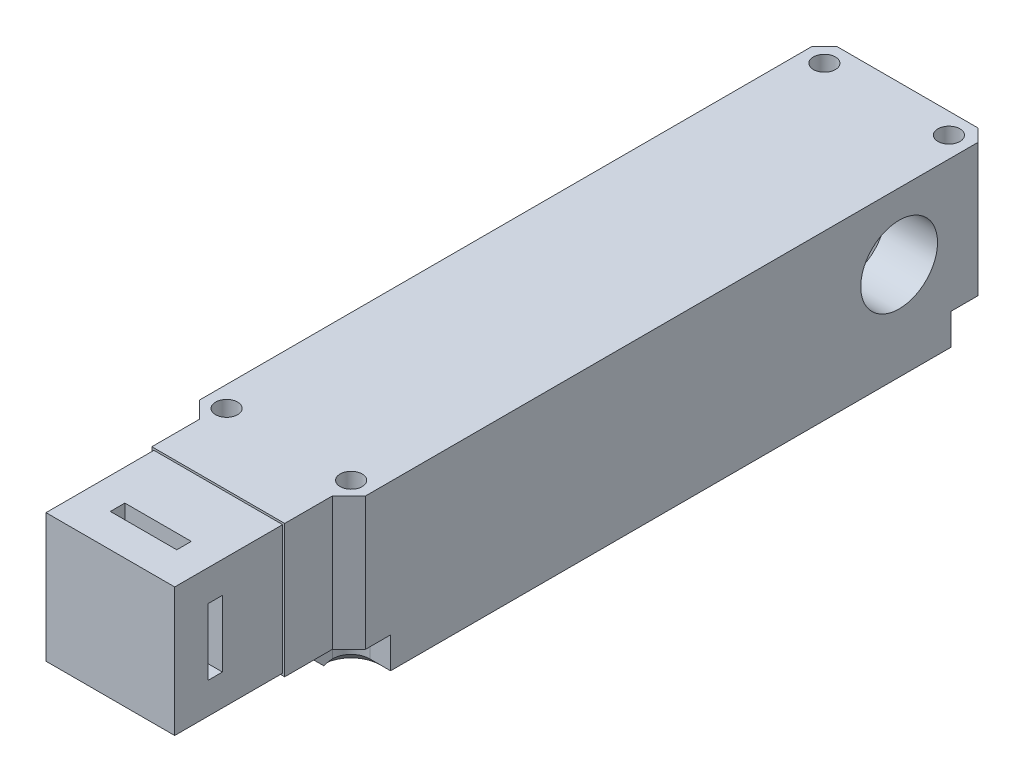
from build123d import *

# Parameters (mm, degrees)
SKIZZE1_R                       = 2.65
AUFSATZ_LINEAR_AUSTRAGEN1_DEPTH = 32
SKIZZE2_W                       = 31
SKIZZE2_H                       = 31
AUFSATZ_LINEAR_AUSTRAGEN2_DEPTH = 26
AUFSATZ_LINEAR_AUSTRAGEN3_DEPTH = 10
FASE2_SIZE                      = 4.5
FASE1_SIZE                      = 2.5
M20X1_5_GEWINDEBOHRUNG1_D       = 18.5
M20X1_5_GEWINDEBOHRUNG1_DEPTH   = 8
M20X1_5_GEWINDEBOHRUNG1_TIP     = 5.557960726
M20X1_5_GEWINDEBOHRUNG2_D       = 18.5
M20X1_5_GEWINDEBOHRUNG2_DEPTH   = 12.5
M20X1_5_GEWINDEBOHRUNG2_TIP     = 5.557960726
M20X1_5_GEWINDEBOHRUNG3_D       = 18.5
M20X1_5_GEWINDEBOHRUNG3_DEPTH   = 12.5
M20X1_5_GEWINDEBOHRUNG3_TIP     = 5.557960726
SKIZZE10_W                      = 6
SKIZZE10_H                      = 16
SKIZZE10_W_2                    = 16
SKIZZE10_H_2                    = 6
SCHNITT_LINEAR_AUSTRAGEN1_DEPTH = 3.5


with BuildPart() as part:
    # Skizze1 → Aufsatz-Linear austragen1 (new body)
    with BuildSketch(Plane(origin=(0, 0, 0), x_dir=(1, 0, 0), z_dir=(0, 1, 0))):
        Polygon((16, -17), (-16, -17), (-16, -5.5), (-20, -1.5), (-20, 146), (-17, 149), (17, 149), (20, 146), (20, -1.5), (16, -5.5), align=None)
        with Locations(Location((15, 0, 0), (0, 0, 270))):
            Circle(SKIZZE1_R, mode=Mode.SUBTRACT)
        with Locations(Location((-15, 0, 0), (0, 0, 270))):
            Circle(SKIZZE1_R, mode=Mode.SUBTRACT)
        with Locations(Location((-15, 144, 0), (0, 0, 270))):
            Circle(SKIZZE1_R, mode=Mode.SUBTRACT)
        with Locations(Location((15, 144, 0), (0, 0, 270))):
            Circle(SKIZZE1_R, mode=Mode.SUBTRACT)
    extrude(amount=-AUFSATZ_LINEAR_AUSTRAGEN1_DEPTH)

    # Skizze2 → Aufsatz-Linear austragen2 (add)
    with BuildSketch(Plane.XY.offset(17)):
        with Locations((0, -16)):
            Rectangle(SKIZZE2_W, SKIZZE2_H)
    extrude(amount=AUFSATZ_LINEAR_AUSTRAGEN2_DEPTH)

    # Skizze3 → Aufsatz-Linear austragen3 (add)
    with BuildSketch(Plane.XZ.offset(32)):
        with BuildLine():
            Line((20, -4.5), (15, -4.5))
            ThreePointArc((15, -4.5), (11.818019485, -3.181980515), (10.5, 0))
            Line((10.5, 0), (10.5, 4.5))
            Line((10.5, 4.5), (-10.5, 4.5))
            Line((-10.5, 4.5), (-10.5, 0))
            ThreePointArc((-10.5, 0), (-11.818019485, -3.181980515), (-15, -4.5))
            Line((-15, -4.5), (-20, -4.5))
            Line((-20, -4.5), (-20, -139.5))
            Line((-20, -139.5), (-15, -139.5))
            ThreePointArc((-15, -139.5), (-11.818019485, -140.818019485), (-10.5, -144))
            Line((-10.5, -144), (-10.5, -149))
            Line((-10.5, -149), (10.5, -149))
            Line((10.5, -149), (10.5, -144))
            ThreePointArc((10.5, -144), (11.818019485, -140.818019485), (15, -139.5))
            Line((15, -139.5), (20, -139.5))
            Line((20, -139.5), (20, -4.5))
        make_face()
    extrude(amount=AUFSATZ_LINEAR_AUSTRAGEN3_DEPTH)

    # Fase2
    fase2_edges = [part.edges().sort_by_distance(p)[0] for p in [
        (0, -42, 4.5),
        (0, -42, -149),
    ]]
    chamfer(fase2_edges, length=FASE2_SIZE)

    # Fase1
    # the kernel refuses this chamfer: 2.5 mm, written as the material it takes off along each edge
    with BuildSketch(Plane(origin=(10.5, -42, -150.92920747), x_dir=(0.027495876610586282, 0.9996219169112968, 0), z_dir=(0, 0, 1)), Plane(origin=(-10.5, -42, -144), x_dir=(-0.027495876610586282, 0.9996219169112968, 0), z_dir=(0, 0, -1))) as fase1_piece_1:
        Polygon((FASE1_SIZE * 0.999621916911, FASE1_SIZE * 0.0274958766106), (-FASE1_SIZE * 0.0274958766106, FASE1_SIZE * 0.999621916911), (0, 0), align=None)
    extrude(amount=6.92920747, mode=Mode.SUBTRACT)
    with BuildSketch(Plane(origin=(20, -42, -145.92920747), x_dir=(-0.9996219169112968, -0.0274958766105877, 0), z_dir=(0, 0, 1)), Plane(origin=(-20, -42, 1.92920747), x_dir=(0.9996219169112968, -0.0274958766105877, 0), z_dir=(0, 0, -1))) as fase1_piece_2:
        Polygon((FASE1_SIZE * 0.999621916911, -FASE1_SIZE * 0.0274958766106), (-FASE1_SIZE * 0.0274958766106, -FASE1_SIZE * 0.999621916911), (0, 0), align=None)
    extrude(amount=147.85841494, mode=Mode.SUBTRACT)
    with BuildSketch(Plane(origin=(26.42920747, -42, -4.5), x_dir=(0, -0.0274958766105877, -0.9996219169112968), z_dir=(-1, 0, 0)), Plane(origin=(-15, -42, -4.5), x_dir=(0, -0.0274958766105877, -0.9996219169112968), z_dir=(-1, 0, 0)), Plane(origin=(-26.42920747, -42, -139.5), x_dir=(0, -0.027495876610587815, 0.9996219169112968), z_dir=(1, 0, 0)), Plane(origin=(15, -42, -139.5), x_dir=(0, -0.027495876610587815, 0.9996219169112968), z_dir=(1, 0, 0))) as fase1_piece_3:
        Polygon((FASE1_SIZE * 0.999621916911, -FASE1_SIZE * 0.0274958766106), (-FASE1_SIZE * 0.0274958766106, -FASE1_SIZE * 0.999621916911), (0, 0), align=None)
    extrude(amount=11.42920747, mode=Mode.SUBTRACT)
    with BuildSketch(Plane(origin=(15, -42, 0), x_dir=(0, 0, -1), z_dir=(1, 0, 0))) as fase1_piece_4:
        Polygon((4.5 + FASE1_SIZE, 0), (4.5, FASE1_SIZE), (4.5, 0), align=None)
    revolve(axis=Axis((15, -42, 0), (0, 1, 0)), revolution_arc=171.892095433, mode=Mode.SUBTRACT)
    with BuildSketch(Plane(origin=(-15, -42, 0), x_dir=(0.14103781497281773, 0, 0.9900042094595827), z_dir=(-0.9900042094595827, 0, 0.14103781497281773))) as fase1_piece_5:
        Polygon((4.5 + FASE1_SIZE, 0), (4.5, FASE1_SIZE), (4.5, 0), align=None)
    revolve(axis=Axis((-15, -42, 0), (0, 1, 0)), revolution_arc=171.892095433, mode=Mode.SUBTRACT)
    with BuildSketch(Plane(origin=(-15, -42, -144), x_dir=(0, 0, 1), z_dir=(-1, 0, 0))) as fase1_piece_6:
        Polygon((4.5 + FASE1_SIZE, 0), (4.5, FASE1_SIZE), (4.5, 0), align=None)
    revolve(axis=Axis((-15, -42, -144), (0, 1, 0)), revolution_arc=90, mode=Mode.SUBTRACT)
    with BuildSketch(Plane(origin=(15, -42, -144), x_dir=(-1, 0, 0), z_dir=(0, 0, -1))) as fase1_piece_7:
        Polygon((4.5 + FASE1_SIZE, 0), (4.5, FASE1_SIZE), (4.5, 0), align=None)
    revolve(axis=Axis((15, -42, -144), (0, 1, 0)), revolution_arc=90, mode=Mode.SUBTRACT)

    # M20x1.5 Gewindebohrung1
    with Locations(Plane(origin=(0, 0, -149), x_dir=(-1, 0, 0), z_dir=(0, 0, -1))):
        with Locations((0, -16)):
            Hole(M20X1_5_GEWINDEBOHRUNG1_D / 2, depth=M20X1_5_GEWINDEBOHRUNG1_DEPTH)
            with Locations((0, 0, -(M20X1_5_GEWINDEBOHRUNG1_DEPTH + M20X1_5_GEWINDEBOHRUNG1_TIP / 2))):  # 118° drill point
                Cone(0, M20X1_5_GEWINDEBOHRUNG1_D / 2, M20X1_5_GEWINDEBOHRUNG1_TIP, mode=Mode.SUBTRACT)

    # M20x1.5 Gewindebohrung2
    with Locations(Plane.ZY.offset(20)):
        with Locations((-127, -16)):
            Hole(M20X1_5_GEWINDEBOHRUNG2_D / 2, depth=M20X1_5_GEWINDEBOHRUNG2_DEPTH)
            with Locations((0, 0, -(M20X1_5_GEWINDEBOHRUNG2_DEPTH + M20X1_5_GEWINDEBOHRUNG2_TIP / 2))):  # 118° drill point
                Cone(0, M20X1_5_GEWINDEBOHRUNG2_D / 2, M20X1_5_GEWINDEBOHRUNG2_TIP, mode=Mode.SUBTRACT)

    # M20x1.5 Gewindebohrung3
    with Locations(Plane(origin=(20, 0, 0), x_dir=(0, 0, -1), z_dir=(1, 0, 0))):
        with Locations((127, -16)):
            Hole(M20X1_5_GEWINDEBOHRUNG3_D / 2, depth=M20X1_5_GEWINDEBOHRUNG3_DEPTH)
            with Locations((0, 0, -(M20X1_5_GEWINDEBOHRUNG3_DEPTH + M20X1_5_GEWINDEBOHRUNG3_TIP / 2))):  # 118° drill point
                Cone(0, M20X1_5_GEWINDEBOHRUNG3_D / 2, M20X1_5_GEWINDEBOHRUNG3_TIP, mode=Mode.SUBTRACT)

    # Skizze10 → Schnitt-Linear austragen1 (cut)
    with BuildSketch(Plane.XY.offset(35)):
        with Locations((12.5, -16)):
            Rectangle(SKIZZE10_W, SKIZZE10_H)
        with Locations((0, -28.5)):
            Rectangle(SKIZZE10_W_2, SKIZZE10_H_2)
        with Locations((-12.5, -16)):
            Rectangle(SKIZZE10_W, SKIZZE10_H)
        with Locations((0, -3.5)):
            Rectangle(SKIZZE10_W_2, SKIZZE10_H_2)
    extrude(amount=-SCHNITT_LINEAR_AUSTRAGEN1_DEPTH, mode=Mode.SUBTRACT)


solid = part.part
